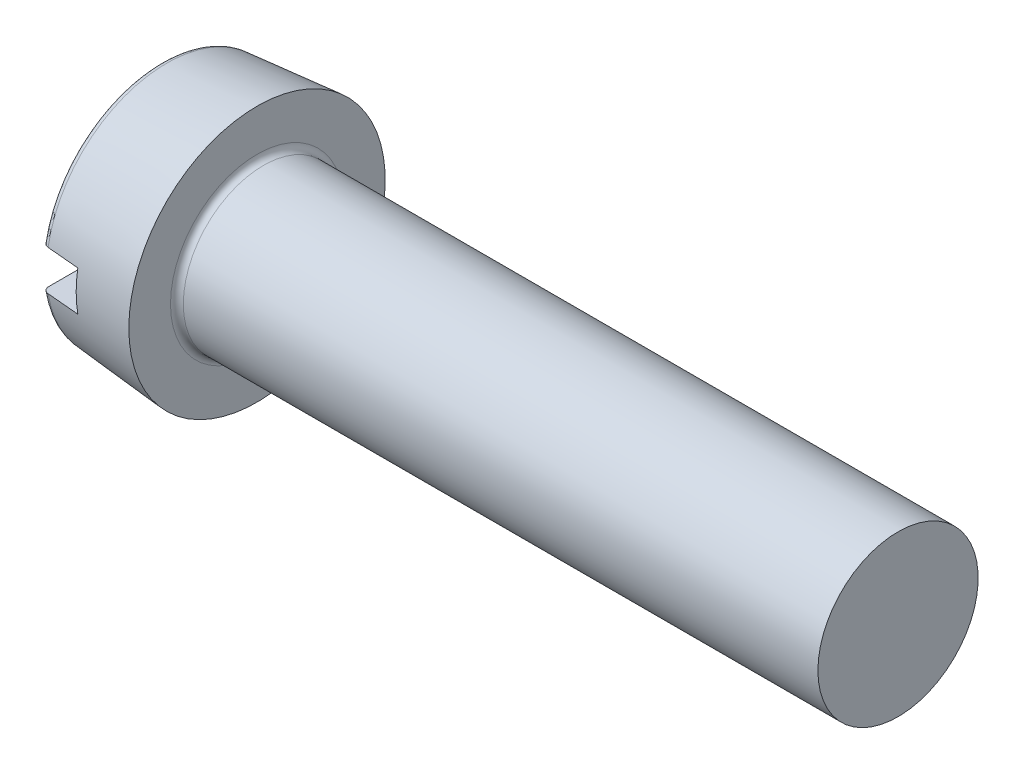
from build123d import *

# Parameters (mm, degrees)
FILLET1_R  = 0.4
FILLET2_R  = 0.4
SLOTSKE_W  = 16
SLOTSKE_H  = 2.5
SLOT_DEPTH = 2.4


with BuildPart() as part:
    # BodySke → BaseBody (revolve)
    with BuildSketch(Plane.XY):
        Polygon((0, 0), (0, 7.475068019), (6, 8), (6, 5), (46, 5), (46, 0), align=None)
    revolve(axis=Axis((0, 0, 0), (1, 0, 0)))

    # Fillet1
    fillet1_edges = [part.edges().sort_by_distance(p)[0] for p in [
        (6, -5, 0),
    ]]
    fillet(fillet1_edges, radius=FILLET1_R)

    # Fillet2
    fillet2_edges = [part.edges().sort_by_distance(p)[0] for p in [
        (0, -7.475068019, 0),
    ]]
    fillet(fillet2_edges, radius=FILLET2_R)

    # SlotSke → Slot (cut)
    with BuildSketch(Plane.ZY):
        Rectangle(SLOTSKE_W, SLOTSKE_H)
    extrude(amount=-SLOT_DEPTH, mode=Mode.SUBTRACT)


solid = part.part
